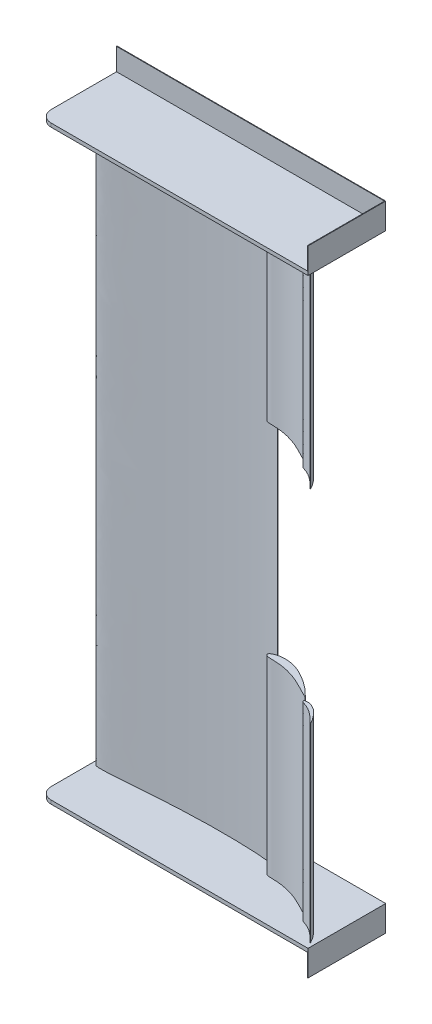
from build123d import *

# Parameters (mm, degrees)
SKETCH2_W           = 585.47
SKETCH2_H           = 8
EXTRUDE_THIN1_DEPTH = 169.3
BOSS_EXTRUDE1_START = -635
BOSS_EXTRUDE1_DEPTH = 635
EXTRUDE_THIN2_REACH = 1150.44
FILLET1_R           = 25.4
CUT_EXTRUDE1_DEPTH  = 221.35


# Read off the part's stored shape, not the designer's step: Boss-Extrude1
with BuildPart() as part:
    # Sketch2 → Extrude-Thin1 (new body)
    with BuildSketch(Plane.XY.offset(50.8)):
        with Locations((-597.765, -639)):
            Rectangle(SKETCH2_W, SKETCH2_H)
    extrude(amount=EXTRUDE_THIN1_DEPTH)

    # Sketch6 → Extrude-Thin2 (add, up to next)
    with BuildSketch(Plane(origin=(0, -691, 0), x_dir=(1, 0, 0), z_dir=(0, 1, 0)), mode=Mode.PRIVATE) as extrude_thin2_sk1:
        Polygon((-890.5, -50.8), (-305.03, -50.8), (-305.03, -220.1), (-306.3, -220.1), (-306.3, -52.07), (-890.5, -52.07), align=None)
    extrude_thin2_tool1 = extrude(extrude_thin2_sk1.sketch, amount=EXTRUDE_THIN2_REACH, mode=Mode.PRIVATE) - part.part
    add(extrude_thin2_tool1.solids().sort_by_distance((-597.765, -691, 51.409457))[0])

    # Fillet1
    fillet1_edges = [part.edges().sort_by_distance(p)[0] for p in [
        (-890.5, -639, 220.1),
    ]]
    fillet(fillet1_edges, radius=FILLET1_R)


with BuildPart() as body_2:
    # Boss-Extrude1 outline → Boss-Extrude1 (new body)
    with BuildSketch(Plane(origin=(0, 0, 0), x_dir=(1, 0, 0), z_dir=(0, 1, 0)).offset(BOSS_EXTRUDE1_START)):
        with BuildLine():
            Line((-313.322274033, -207.819275468), (-312.734488781, -207.010258473))
            add(Edge.make_bspline(
                [(-312.734488781, -207.010258473), (-312.94790025, -206.595835787), (-313.163471152, -206.182768149), (-314.076772857, -204.457154385), (-314.795572271, -203.157828862), (-316.286923829, -200.592907783), (-317.832061716, -198.061737756), (-319.494608729, -195.604242237), (-321.218319307, -193.185127003), (-322.110746687, -191.994753446), (-323.264536941, -190.53079225), (-323.497202406, -190.239196918), (-323.966328586, -189.658387782), (-324.202808735, -189.369155172), (-324.916322458, -188.506884476), (-326.361186052, -186.802127831), (-327.857540884, -185.154487853), (-329.894351193, -183.003857596), (-330.93272728, -181.950695228), (-332.535567898, -180.42117463), (-333.077451925, -179.919768971), (-334.180131194, -178.93793492), (-334.740900621, -178.457477895), (-336.459238409, -177.056072556), (-337.653403721, -176.175719417), (-339.523079354, -174.942185612), (-340.159404222, -174.545538475), (-341.134604438, -173.973543572), (-341.463299261, -173.786616551), (-342.127093943, -173.421075828), (-342.461094802, -173.243061553), (-344.141714009, -172.37699067), (-345.519947952, -171.760417428), (-347.288488889, -171.093138988), (-347.644500203, -170.964890706), (-348.361293339, -170.719180336), (-348.72165413, -170.601880133), (-349.804231226, -170.26850397), (-350.529643838, -170.07029295), (-351.988314447, -169.724919419), (-352.721565725, -169.57771318), (-354.196751367, -169.339799983), (-354.938670169, -169.248991761), (-356.432723048, -169.133844263), (-357.18481372, -169.109222559), (-358.133191267, -169.132219132), (-358.323285941, -169.139545876), (-358.704392294, -169.160166148), (-358.895330345, -169.173466716), (-359.46619646, -169.22289108), (-359.845258432, -169.268504528), (-360.41110543, -169.359871519), (-360.599424151, -169.394210185), (-360.973448584, -169.471182426), (-361.159354757, -169.513638273), (-361.528228331, -169.609097598), (-361.711166762, -169.662205044), (-361.982186638, -169.754025354), (-362.071957409, -169.786675008), (-362.250089287, -169.857033781), (-362.338624609, -169.894833611), (-362.598964019, -170.016441699), (-362.76624205, -170.108503145), (-363.003222604, -170.270976698), (-363.080257558, -170.329566476), (-363.22542479, -170.454395699), (-363.362129765, -170.587142581), (-363.479772645, -170.737724794), (-363.587177024, -170.897886597), (-363.634826141, -170.981437929), (-363.718170629, -171.152982784), (-363.754076929, -171.241270348), (-363.815861025, -171.422219961), (-363.841789922, -171.515138405), (-363.863234025, -171.609072653)],
                knots=[0.042920651, 0.042920651, 0.042920651, 0.042920651, 0.0625, 0.0625, 0.125, 0.125, 0.1875, 0.25, 0.25, 0.3125, 0.3125, 0.328125, 0.328125, 0.34375, 0.34375, 0.375, 0.4375, 0.4375, 0.5, 0.5, 0.53125, 0.53125, 0.5625, 0.5625, 0.625, 0.625, 0.65625, 0.65625, 0.671875, 0.671875, 0.6875, 0.6875, 0.75, 0.75, 0.765625, 0.765625, 0.78125, 0.78125, 0.8125, 0.8125, 0.84375, 0.84375, 0.875, 0.875, 0.90625, 0.90625, 0.9140625, 0.9140625, 0.921875, 0.921875, 0.9375, 0.9375, 0.9453125, 0.9453125, 0.953125, 0.953125, 0.9609375, 0.9609375, 0.96484375, 0.96484375, 0.96875, 0.96875, 0.9765625, 0.9765625, 0.98046875, 0.98046875, 0.984375, 0.98828125, 0.98828125, 0.9921875, 0.9921875, 0.99609375, 0.99609375, 1, 1, 1, 1], degree=3))
            add(Edge.make_bspline(
                [(-363.863234025, -171.609072653), (-363.873224422, -171.652834824), (-363.874536121, -171.696601599), (-363.870530288, -171.784138666), (-363.864655338, -171.828186481), (-363.840252735, -171.957920834), (-363.815274834, -172.041435441), (-363.755582926, -172.205139031), (-363.720603073, -172.285237206), (-363.642192023, -172.442546776), (-363.599318307, -172.518529624), (-363.460254354, -172.738866399), (-363.35365795, -172.875637628), (-363.177418659, -173.0688836), (-363.11574457, -173.1314773), (-362.989466022, -173.251531809), (-362.924693823, -173.309205607), (-362.726389622, -173.47647986), (-362.588904313, -173.580382603), (-362.307067903, -173.778292753), (-362.162738161, -173.872330945), (-361.869781505, -174.05421402), (-361.720998213, -174.141833522), (-361.419433493, -174.311310208), (-361.266510539, -174.393234301), (-360.804856453, -174.630513908), (-360.492605955, -174.777840178), (-359.862088363, -175.05791127), (-359.5438158, -175.190642838), (-358.58328281, -175.574986288), (-357.935507691, -175.813233105), (-356.636517684, -176.281390331), (-355.985114726, -176.511083687), (-354.684987463, -176.976424359), (-354.036258503, -177.211915108), (-352.745074385, -177.696154332), (-352.102583404, -177.944827104), (-350.825581728, -178.4590365), (-350.191051231, -178.724531278), (-348.300522856, -179.548620432), (-347.057703154, -180.135062781), (-344.607510698, -181.382853557), (-343.400020081, -182.043952919), (-341.613374497, -183.087565987), (-341.02191348, -183.44407469), (-339.846790471, -184.173572908), (-339.262459341, -184.547012295), (-338.10597566, -185.30637856), (-337.533513566, -185.692468293), (-336.399334739, -186.47655853), (-335.837461656, -186.874385727), (-334.724621705, -187.682129192), (-334.173864938, -188.092278348), (-333.084709009, -188.926274533), (-332.546297612, -189.350108001), (-330.949757456, -190.642329938), (-329.910494487, -191.531630326), (-328.385442381, -192.903093696), (-327.882463245, -193.366202303), (-326.88417477, -194.300921157), (-326.388877869, -194.772545191), (-324.911173227, -196.196491191), (-323.936789054, -197.157706936), (-321.997553758, -199.090705404), (-321.032798266, -200.06259413), (-319.105398464, -202.008711734), (-318.1427983, -202.982989547), (-316.214538268, -204.928153624), (-315.248901214, -205.899065175), (-313.961026513, -207.184295143), (-313.641862845, -207.502020932), (-313.322274033, -207.819275468)],
                knots=[0, 0, 0, 0, 0.001953125, 0.001953125, 0.00390625, 0.00390625, 0.0078125, 0.0078125, 0.01171875, 0.01171875, 0.015625, 0.015625, 0.0234375, 0.0234375, 0.02734375, 0.02734375, 0.03125, 0.03125, 0.0390625, 0.0390625, 0.046875, 0.046875, 0.0546875, 0.0546875, 0.0625, 0.0625, 0.078125, 0.078125, 0.09375, 0.09375, 0.125, 0.125, 0.15625, 0.15625, 0.1875, 0.1875, 0.21875, 0.21875, 0.25, 0.25, 0.3125, 0.3125, 0.375, 0.375, 0.40625, 0.40625, 0.4375, 0.4375, 0.46875, 0.46875, 0.5, 0.5, 0.53125, 0.53125, 0.5625, 0.5625, 0.625, 0.625, 0.65625, 0.65625, 0.6875, 0.6875, 0.75, 0.75, 0.8125, 0.8125, 0.875, 0.875, 0.9375, 0.9375, 0.958060182, 0.958060182, 0.958060182, 0.958060182], degree=3))
        make_face()
        with BuildLine():
            Line((-369.965675379, -162.257694876), (-369.656658385, -161.306638359))
            add(Edge.make_bspline(
                [(-369.656658385, -161.306638359), (-371.044914207, -159.897481159), (-372.446868412, -158.504711907), (-375.999292391, -155.061039175), (-378.16955746, -153.033817635), (-382.591485099, -149.076753775), (-387.09486112, -145.217130011), (-391.776029217, -141.570206318), (-396.549817011, -138.034087428), (-398.983006078, -136.321412824), (-402.082423334, -134.249874747), (-402.705195174, -133.839022631), (-403.956485982, -133.024193929), (-404.585053538, -132.620193582), (-406.475149889, -131.421032985), (-407.742448237, -130.63781402), (-411.565216738, -128.33496277), (-414.141574844, -126.862168634), (-419.344980874, -124.030244793), (-421.9709797, -122.668762643), (-425.965059445, -120.750051559), (-427.305669855, -120.131224067), (-430.009897278, -118.945157991), (-431.373482885, -118.377848988), (-435.508071719, -116.774208785), (-438.323597283, -115.837712357), (-442.642297489, -114.646914721), (-444.097800726, -114.285717427), (-446.306254057, -113.800425347), (-447.046996016, -113.648013597), (-448.535525123, -113.362961499), (-449.280851382, -113.23078211), (-453.012840321, -112.622097188), (-456.015460286, -112.301100611), (-459.791825807, -112.124880002), (-460.548261364, -112.100964367), (-462.063540288, -112.076597991), (-462.821482759, -112.076194963), (-465.086704561, -112.111145258), (-466.589022492, -112.182455144), (-469.577031449, -112.427023665), (-471.062736719, -112.600194972), (-474.015744997, -113.059372045), (-475.483080988, -113.345175579), (-478.396103508, -114.049527482), (-479.841882026, -114.467511817), (-481.631590654, -115.097383456), (-481.988644034, -115.228804722), (-482.700807366, -115.503563489), (-483.055772918, -115.646868878), (-484.111078859, -116.093694267), (-484.803906914, -116.414729383), (-485.823743958, -116.938232404), (-486.160724989, -117.119935799), (-486.824590276, -117.497505514), (-487.151965675, -117.693157669), (-487.794607798, -118.1027085), (-488.109755167, -118.316787034), (-488.568517532, -118.658939137), (-488.71909309, -118.776523857), (-489.014435944, -119.020445751), (-489.159478555, -119.147063138), (-489.579515606, -119.539274071), (-489.840800226, -119.817768856), (-490.191149849, -120.273273957), (-490.301468564, -120.432328557), (-490.500444347, -120.759486131), (-490.678430576, -121.096474026), (-490.809135705, -121.455605714), (-490.914445537, -121.826631124), (-490.953441979, -122.015003975), (-491.005952065, -122.392811407), (-491.019685191, -122.582935646), (-491.025372514, -122.965306936), (-491.017265451, -123.158073257), (-491, -123.35)],
                knots=[0.021001149, 0.021001149, 0.021001149, 0.021001149, 0.0625, 0.0625, 0.125, 0.125, 0.1875, 0.25, 0.25, 0.3125, 0.3125, 0.328125, 0.328125, 0.34375, 0.34375, 0.375, 0.375, 0.4375, 0.4375, 0.5, 0.5, 0.53125, 0.53125, 0.5625, 0.5625, 0.625, 0.625, 0.65625, 0.65625, 0.671875, 0.671875, 0.6875, 0.6875, 0.75, 0.75, 0.765625, 0.765625, 0.78125, 0.78125, 0.8125, 0.8125, 0.84375, 0.84375, 0.875, 0.875, 0.90625, 0.90625, 0.9140625, 0.9140625, 0.921875, 0.921875, 0.9375, 0.9375, 0.9453125, 0.9453125, 0.953125, 0.953125, 0.9609375, 0.9609375, 0.96484375, 0.96484375, 0.96875, 0.96875, 0.9765625, 0.9765625, 0.98046875, 0.98046875, 0.984375, 0.98828125, 0.98828125, 0.9921875, 0.9921875, 0.99609375, 0.99609375, 1, 1, 1, 1], degree=3))
            add(Edge.make_bspline(
                [(-491, -123.35), (-490.991956356, -123.439415), (-490.967402001, -123.523475028), (-490.905681572, -123.687504683), (-490.867283706, -123.767657688), (-490.740686957, -123.999345452), (-490.6415613, -124.142762484), (-490.426846162, -124.417253588), (-490.310807131, -124.547990633), (-490.06443779, -124.798750521), (-489.935927154, -124.916781074), (-489.53523618, -125.249940275), (-489.247948503, -125.44421441), (-488.793288872, -125.702868221), (-488.637292751, -125.78381183), (-488.322898911, -125.934124641), (-488.1640505, -126.003795305), (-487.683472321, -126.199411105), (-487.357744296, -126.312075273), (-486.699344387, -126.514338268), (-486.366694106, -126.604008851), (-485.697047511, -126.768913848), (-485.359893041, -126.843622914), (-484.681540504, -126.979609479), (-484.340031887, -127.040926781), (-483.315266772, -127.206941498), (-482.630278387, -127.294191296), (-481.257869204, -127.437236868), (-480.570446195, -127.493004051), (-478.50586656, -127.630426701), (-477.126480433, -127.683252037), (-474.366317535, -127.770920022), (-472.985317177, -127.805233578), (-470.224731814, -127.886841298), (-468.845234718, -127.933834773), (-466.089980282, -128.056916843), (-464.714201587, -128.132839299), (-461.967401172, -128.321693252), (-460.596367649, -128.434532916), (-456.491053881, -128.833632844), (-453.764629025, -129.18100766), (-448.332908911, -130.04014454), (-445.627543397, -130.551360011), (-441.584153199, -131.432222331), (-440.238792994, -131.744799171), (-437.552721511, -132.406121277), (-436.210459419, -132.755308703), (-433.541382575, -133.484962949), (-432.213878388, -133.865548232), (-429.571947643, -134.656015426), (-428.2573308, -135.06547106), (-425.641370511, -135.914117517), (-424.340282769, -136.353881171), (-421.753147092, -137.2671008), (-420.467084268, -137.740523419), (-416.631647351, -139.211759526), (-414.105233848, -140.261009546), (-410.356801385, -141.927153861), (-409.113861356, -142.497180576), (-406.637315815, -143.658145281), (-405.403725442, -144.249117183), (-401.712917159, -146.044351734), (-399.265464323, -147.270490193), (-394.382160839, -149.748758445), (-391.94642658, -151.001148972), (-387.077527472, -153.511686042), (-384.644416351, -154.769952949), (-379.774470302, -157.278144651), (-377.337663138, -158.528131646), (-373.255075712, -160.603030959), (-371.611599318, -161.433104425), (-369.965675379, -162.257694876)],
                knots=[0, 0, 0, 0, 0.001953125, 0.001953125, 0.00390625, 0.00390625, 0.0078125, 0.0078125, 0.01171875, 0.01171875, 0.015625, 0.015625, 0.0234375, 0.0234375, 0.02734375, 0.02734375, 0.03125, 0.03125, 0.0390625, 0.0390625, 0.046875, 0.046875, 0.0546875, 0.0546875, 0.0625, 0.0625, 0.078125, 0.078125, 0.09375, 0.09375, 0.125, 0.125, 0.15625, 0.15625, 0.1875, 0.1875, 0.21875, 0.21875, 0.25, 0.25, 0.3125, 0.3125, 0.375, 0.375, 0.40625, 0.40625, 0.4375, 0.4375, 0.46875, 0.46875, 0.5, 0.5, 0.53125, 0.53125, 0.5625, 0.5625, 0.625, 0.625, 0.65625, 0.65625, 0.6875, 0.6875, 0.75, 0.75, 0.8125, 0.8125, 0.875, 0.875, 0.9375, 0.9375, 0.979531613, 0.979531613, 0.979531613, 0.979531613], degree=3))
        make_face()
        with BuildLine():
            add(Edge.make_bspline(
                [(-882.5, -104.1), (-882.513949566, -103.852621874), (-882.437928049, -102.410460465), (-880.557161442, -100.005796427), (-877.31718835, -96.582143824), (-872.23651345, -92.975913048), (-865.627182644, -89.214765188), (-857.397910186, -85.458593896), (-847.640707208, -81.800257412), (-836.415727937, -78.31300605), (-823.81317646, -75.092688452), (-809.948978901, -72.180956801), (-794.950333299, -69.649999408), (-778.958753787, -67.562356112), (-762.134548694, -65.955646231), (-744.624133421, -64.914421038), (-726.558021858, -64.540285591), (-708.04528106, -64.865458052), (-689.192479716, -65.881372072), (-670.11203134, -67.535618696), (-650.928271426, -69.775971653), (-631.783124426, -72.490968561), (-612.850253171, -75.505537636), (-594.345135975, -78.701747611), (-576.501993567, -81.996418998), (-559.545053093, -85.287972233), (-543.692441564, -88.52233191), (-529.152155716, -91.613399817), (-516.103327338, -94.511992016), (-504.754950247, -97.159781405), (-496.181176099, -99.326978191), (-491.579360264, -100.570755883), (-490.07199635, -100.983746807)],
                knots=[0.493435359, 0.493435359, 0.493435359, 0.493435359, 0.494288159, 0.498332481, 0.504063293, 0.511512566, 0.52071275, 0.531630121, 0.544234393, 0.558451329, 0.57419547, 0.591347019, 0.609766141, 0.629293713, 0.649767629, 0.670989497, 0.692835359, 0.715223012, 0.738060254, 0.761229178, 0.784604179, 0.80803111, 0.831285798, 0.854064349, 0.876070739, 0.897027321, 0.916650297, 0.934688014, 0.950897205, 0.965048606, 0.977008021, 0.982681427, 0.982681427, 0.982681427, 0.982681427], degree=3))
            add(Edge.make_bspline(
                [(-490.073741678, -101.983745284), (-492.618157915, -101.546705659), (-498.963826942, -100.594133899), (-510.369654764, -99.257487573), (-524.604470835, -97.982822459), (-540.955318787, -96.862010369), (-559.121688216, -95.954335154), (-578.865885335, -95.303638728), (-599.904920964, -94.923269203), (-621.949852933, -94.843570133), (-644.700641851, -95.057284301), (-667.848524392, -95.567556804), (-691.083342597, -96.349456854), (-714.091452781, -97.383986432), (-736.570413091, -98.606367018), (-758.223519292, -99.986523328), (-778.774953052, -101.44817932), (-797.965903322, -102.92329261), (-815.562233634, -104.330620195), (-831.363134854, -105.591374032), (-845.184331686, -106.608297145), (-856.925233372, -107.328642062), (-866.395637757, -107.62585309), (-873.820784018, -107.543467434), (-878.588363864, -106.80969512), (-882.082310061, -106.012863584), (-882.473838715, -104.563937705), (-882.5, -104.1)],
                knots=[0.017037645, 0.017037645, 0.017037645, 0.017037645, 0.026243174, 0.040890739, 0.058280082, 0.078153291, 0.100225847, 0.124193473, 0.149723047, 0.17646636, 0.204065263, 0.232156188, 0.260355063, 0.288296453, 0.31560291, 0.34192098, 0.366909104, 0.390253574, 0.411658524, 0.430871129, 0.447677604, 0.461896385, 0.473415341, 0.48219946, 0.488293664, 0.491836002, 0.493435359, 0.493435359, 0.493435359, 0.493435359], degree=3))
            Line((-490.073741678, -101.983745284), (-490.07199635, -100.983746807))
        make_face()
    extrude(amount=BOSS_EXTRUDE1_DEPTH)

    # Sketch7 → Cut-Extrude1 (cut)
    with BuildSketch(Plane(origin=(0, 0, 0), x_dir=(1, 0, 0), z_dir=(0, 1, 0))):
        Polygon((-300, -257.809132326), (-345, -257.809132326), (-543.017775914, -152.809132326), (-543.017775914, -107.809132326), (-300, -107.809132326), align=None)
    extrude(amount=-CUT_EXTRUDE1_DEPTH, mode=Mode.SUBTRACT)


with BuildPart() as part_1:
    add(part.part)

    # Combine1: union body 2
    add(body_2.part)

    # Mirror1: part across plane


with BuildPart() as part_2:
    add(part_1.part)
    add(part_1.part.mirror(Plane.ZX))


solid = part_2.part
